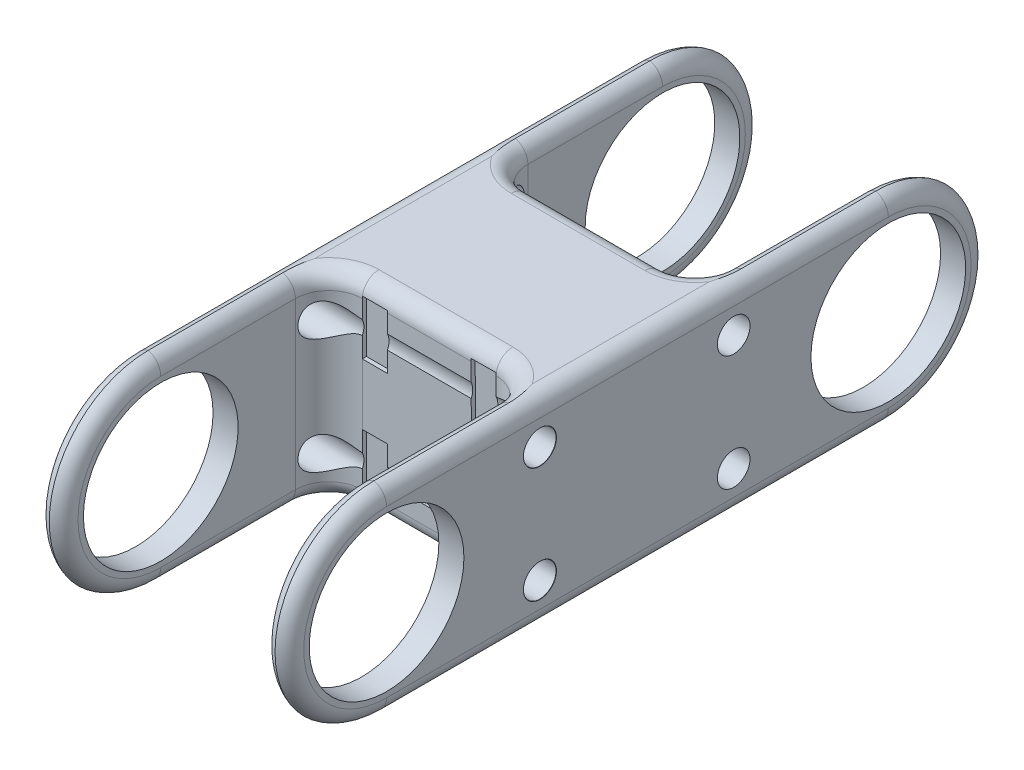
from build123d import *
from OCP.BRepAlgoAPI import BRepAlgoAPI_Cut
from OCP.TopTools import TopTools_ListOfShape

# Parameters (mm, degrees)
SKETCH1_R                        = 9.25
BOSS_EXTRUDE1_DEPTH              = 30
SKETCH2_W                        = 24
SKETCH2_H                        = 32
CUT_EXTRUDE1_DEPTH               = 82.46195431
FILLET1_R                        = 4
M3_5_CLEARANCE_HOLE1_D           = 3.9
M3_5_CLEARANCE_HOLE1_CSINK_D     = 3.95
M3_5_CLEARANCE_HOLE1_CSINK_ANGLE = 90
SKETCH5_W                        = 3
SKETCH5_H                        = 6.5
CUT_EXTRUDE2_DEPTH               = 0.5
M3_5_CLEARANCE_HOLE2_D           = 3.9
M3_5_CLEARANCE_HOLE2_CSINK_D     = 3.95
M3_5_CLEARANCE_HOLE2_CSINK_ANGLE = 90
SKETCH10_W                       = 3
SKETCH10_H                       = 6.5
CUT_EXTRUDE3_DEPTH               = 0.5
FILLET2_R                        = 2
M3_5_CLEARANCE_HOLE3_D           = 3.9
M3_5_CLEARANCE_HOLE3_CSINK_D     = 3.95
M3_5_CLEARANCE_HOLE3_CSINK_ANGLE = 90


with BuildPart() as part:
    # Sketch1 → Boss-Extrude1 (new body)
    with BuildSketch(Plane(origin=(0, 0, 0), x_dir=(0, 0, -1), z_dir=(1, 0, 0))):
        with BuildLine():
            Line((0, 11.9), (60, 11.9))
            ThreePointArc((60, 11.9), (71.9, 0), (60, -11.9))
            Line((60, -11.9), (0, -11.9))
            ThreePointArc((0, -11.9), (-11.9, 0), (0, 11.9))
        make_face()
        Circle(SKETCH1_R, mode=Mode.SUBTRACT)
        with Locations(Location((60, 0, 0), (0, 0, 180))):
            Circle(SKETCH1_R, mode=Mode.SUBTRACT)
    extrude(amount=BOSS_EXTRUDE1_DEPTH)

    # Sketch2 → Cut-Extrude1 (cut, through all)
    with BuildSketch(Plane(origin=(0, 11.9, 0), x_dir=(1, 0, 0), z_dir=(0, 1, 0))):
        with Locations((15, 4.1)):
            Rectangle(SKETCH2_W, SKETCH2_H)
        with Locations((15, 55.9)):
            Rectangle(SKETCH2_W, SKETCH2_H)
    extrude(amount=-CUT_EXTRUDE1_DEPTH, mode=Mode.SUBTRACT)

    # Fillet1
    fillet1_edges = [part.edges().sort_by_distance(p)[0] for p in [
        (27, 0, -20.1),
        (3, 0, -20.1),
        (3, 0, -39.9),
        (27, 0, -39.9),
    ]]
    fillet(fillet1_edges, radius=FILLET1_R)

    # M3.5 Clearance Hole1 (through all)
    with Locations(Plane.ZY):
        with Locations((-41.511047489, -6.9), (-41.511047489, 6.9)):
            CounterSinkHole(M3_5_CLEARANCE_HOLE1_D / 2, M3_5_CLEARANCE_HOLE1_CSINK_D / 2, counter_sink_angle=M3_5_CLEARANCE_HOLE1_CSINK_ANGLE)


with BuildPart() as cut_extrude2_tool:
    # Sketch5 → Cut-Extrude2 (new body)
    with BuildSketch(Plane(origin=(0, 0, -39.9), x_dir=(-1, 0, 0), z_dir=(0, 0, -1))):
        with Locations((-21.5, -6.9)):
            Rectangle(SKETCH5_W, SKETCH5_H)
        Polygon((-7.010026022, -10.209613265), (-10.009942628, -10.187244585), (-9.961477154, -3.687425272), (-6.961560548, -3.709793952), align=None)
        Polygon((-6.961560548, 3.709793952), (-7.010026022, 10.209613265), (-10.009942628, 10.187244585), (-9.961477154, 3.687425272), align=None)
        with Locations((-21.5, 6.9)):
            Rectangle(SKETCH5_W, SKETCH5_H)
    extrude(amount=-CUT_EXTRUDE2_DEPTH)


with BuildPart() as part_1:
    add(part.part)

    # Cut-Extrude2: cut by cut_extrude2_tool, with a tolerance
    cut_extrude2_stock = TopTools_ListOfShape()
    cut_extrude2_stock.Append(part_1.part.wrapped)
    cut_extrude2_tools = TopTools_ListOfShape()
    cut_extrude2_tools.Append(cut_extrude2_tool.part.wrapped)
    cut_extrude2_cut = BRepAlgoAPI_Cut()
    cut_extrude2_cut.SetArguments(cut_extrude2_stock)
    cut_extrude2_cut.SetTools(cut_extrude2_tools)
    cut_extrude2_cut.SetFuzzyValue(0.00001)
    cut_extrude2_cut.Build()
    add(Compound.cast(cut_extrude2_cut.Shape()).solids(), mode=Mode.REPLACE)

    # M3.5 Clearance Hole2 (through all)
    with Locations(Plane(origin=(30, 0, 0), x_dir=(0, 0, -1), z_dir=(1, 0, 0))):
        with Locations((18.34, 6.9), (18.34, -6.9)):
            CounterSinkHole(M3_5_CLEARANCE_HOLE2_D / 2, M3_5_CLEARANCE_HOLE2_CSINK_D / 2, counter_sink_angle=M3_5_CLEARANCE_HOLE2_CSINK_ANGLE)


with BuildPart() as cut_extrude3_tool:
    # Sketch10 → Cut-Extrude3 (new body)
    with BuildSketch(Plane.XY.offset(-20.1)):
        with Locations((8.5, -6.9)):
            Rectangle(SKETCH10_W, SKETCH10_H)
        Polygon((22.989973978, -10.209613265), (19.990057372, -10.187244585), (20.038522846, -3.687425272), (23.038439452, -3.709793952), align=None)
        Polygon((23.038439452, 3.709793952), (22.989973978, 10.209613265), (19.990057372, 10.187244585), (20.038522846, 3.687425272), align=None)
        with Locations((8.5, 6.9)):
            Rectangle(SKETCH10_W, SKETCH10_H)
    extrude(amount=-CUT_EXTRUDE3_DEPTH)


with BuildPart() as part_2:
    add(part_1.part)

    # Cut-Extrude3: cut by cut_extrude3_tool, with a tolerance
    cut_extrude3_stock = TopTools_ListOfShape()
    cut_extrude3_stock.Append(part_2.part.wrapped)
    cut_extrude3_tools = TopTools_ListOfShape()
    cut_extrude3_tools.Append(cut_extrude3_tool.part.wrapped)
    cut_extrude3_cut = BRepAlgoAPI_Cut()
    cut_extrude3_cut.SetArguments(cut_extrude3_stock)
    cut_extrude3_cut.SetTools(cut_extrude3_tools)
    cut_extrude3_cut.SetFuzzyValue(0.00001)
    cut_extrude3_cut.Build()
    add(Compound.cast(cut_extrude3_cut.Shape()).solids(), mode=Mode.REPLACE)

    # Fillet2
    # the kernel refuses this fillet: 2 mm, written as the material it takes off along each edge
    with BuildSketch(Plane(origin=(0, 0, -60), x_dir=(0, 1, 0), z_dir=(0, 0, 1))) as fillet2_piece_1:
        with BuildLine():
            CenterArc((11.9 - FILLET2_R, -FILLET2_R), FILLET2_R, 0, 90)
            Line((11.9, -FILLET2_R), (11.9, 0))
            Line((11.9, 0), (11.9 - FILLET2_R, 0))
        make_face()
    revolve(axis=Axis((0, 0, -60), (-1, 0, 0)), revolution_arc=180, mode=Mode.SUBTRACT)
    with BuildSketch(Plane(origin=(0, -11.9, -60), x_dir=(1, 0, 0), z_dir=(0, 0, 1)), Plane(origin=(30, 11.9, 0), x_dir=(0, -1, 0), z_dir=(0, 0, -1))) as fillet2_piece_2:
        with BuildLine():
            CenterArc((FILLET2_R, FILLET2_R), FILLET2_R, 180, 90)
            Line((0, FILLET2_R), (0, 0))
            Line((0, 0), (FILLET2_R, 0))
        make_face()
    extrude(amount=60, mode=Mode.SUBTRACT)
    with BuildSketch(Plane(origin=(0, 0, 0), x_dir=(0, -1, 0), z_dir=(0, 0, -1))) as fillet2_piece_3:
        with BuildLine():
            CenterArc((11.9 - FILLET2_R, -FILLET2_R), FILLET2_R, 0, 90)
            Line((11.9 - FILLET2_R, 0), (11.9, 0))
            Line((11.9, 0), (11.9, -FILLET2_R))
        make_face()
    revolve(axis=Axis((0, 0, 0), (-1, 0, 0)), revolution_arc=180, mode=Mode.SUBTRACT)
    with BuildSketch(Plane(origin=(3, 0, -60), x_dir=(0, -1, 0), z_dir=(0, 0, 1))) as fillet2_piece_4:
        with BuildLine():
            CenterArc((11.9 - FILLET2_R, -FILLET2_R), FILLET2_R, 0, 90)
            Line((11.9 - FILLET2_R, 0), (11.9, 0))
            Line((11.9, 0), (11.9, -FILLET2_R))
        make_face()
    revolve(axis=Axis((3, 0, -60), (1, 0, 0)), revolution_arc=180, mode=Mode.SUBTRACT)
    with BuildSketch(Plane(origin=(3, -11.9, -43.9), x_dir=(-1, 0, 0), z_dir=(0, 0, -1)), Plane(origin=(27, -11.9, -60), x_dir=(1, 0, 0), z_dir=(0, 0, 1)), Plane(origin=(27, -11.9, -16.1), x_dir=(1, 0, 0), z_dir=(0, 0, 1)), Plane(origin=(3, -11.9, 0), x_dir=(-1, 0, 0), z_dir=(0, 0, -1))) as fillet2_piece_5:
        with BuildLine():
            CenterArc((FILLET2_R, FILLET2_R), FILLET2_R, 180, 90)
            Line((0, FILLET2_R), (0, 0))
            Line((0, 0), (FILLET2_R, 0))
        make_face()
    extrude(amount=16.1, mode=Mode.SUBTRACT)
    with BuildSketch(Plane(origin=(7, -11.9, -43.9), x_dir=(-1, 0, 0), z_dir=(0, 0, -1))) as fillet2_piece_6:
        with BuildLine():
            CenterArc((4 + FILLET2_R, FILLET2_R), FILLET2_R, 180, 90)
            Line((4, FILLET2_R), (4, 0))
            Line((4, 0), (4 + FILLET2_R, 0))
        make_face()
    revolve(axis=Axis((7, -11.9, -43.9), (0, 1, 0)), revolution_arc=90, mode=Mode.SUBTRACT)
    with BuildSketch(Plane(origin=(23, -11.9, -39.9), x_dir=(0, 0, 1), z_dir=(-1, 0, 0)), Plane(origin=(7, -11.9, -20.1), x_dir=(0, 0, -1), z_dir=(1, 0, 0)), Plane(origin=(7, 11.9, -39.9), x_dir=(0, 0, 1), z_dir=(1, 0, 0)), Plane(origin=(23, 11.9, -20.1), x_dir=(0, 0, -1), z_dir=(-1, 0, 0))) as fillet2_piece_7:
        with BuildLine():
            CenterArc((FILLET2_R, FILLET2_R), FILLET2_R, 180, 90)
            Line((0, FILLET2_R), (0, 0))
            Line((0, 0), (FILLET2_R, 0))
        make_face()
    extrude(amount=16, mode=Mode.SUBTRACT)
    with BuildSketch(Plane(origin=(23, -11.9, -43.9), x_dir=(0, 0, 1), z_dir=(-1, 0, 0))) as fillet2_piece_8:
        with BuildLine():
            CenterArc((4 + FILLET2_R, FILLET2_R), FILLET2_R, 180, 90)
            Line((4, FILLET2_R), (4, 0))
            Line((4, 0), (4 + FILLET2_R, 0))
        make_face()
    revolve(axis=Axis((23, -11.9, -43.9), (0, 1, 0)), revolution_arc=90, mode=Mode.SUBTRACT)
    with BuildSketch(Plane(origin=(27, 0, -60), x_dir=(0, -1, 0), z_dir=(0, 0, 1))) as fillet2_piece_9:
        with BuildLine():
            CenterArc((11.9 - FILLET2_R, FILLET2_R), FILLET2_R, 270, 90)
            Line((11.9 - FILLET2_R, 0), (11.9, 0))
            Line((11.9, 0), (11.9, FILLET2_R))
        make_face()
    revolve(axis=Axis((27, 0, -60), (1, 0, 0)), revolution_arc=180, mode=Mode.SUBTRACT)
    with BuildSketch(Plane(origin=(30, 0, -60), x_dir=(0, 1, 0), z_dir=(0, 0, 1))) as fillet2_piece_10:
        with BuildLine():
            CenterArc((11.9 - FILLET2_R, FILLET2_R), FILLET2_R, 270, 90)
            Line((11.9, FILLET2_R), (11.9, 0))
            Line((11.9, 0), (11.9 - FILLET2_R, 0))
        make_face()
    revolve(axis=Axis((30, 0, -60), (-1, 0, 0)), revolution_arc=180, mode=Mode.SUBTRACT)
    with BuildSketch(Plane(origin=(30, -11.9, -60), x_dir=(-1, 0, 0), z_dir=(0, 0, 1)), Plane(origin=(0, 11.9, 0), x_dir=(0, -1, 0), z_dir=(0, 0, -1))) as fillet2_piece_11:
        with BuildLine():
            CenterArc((FILLET2_R, -FILLET2_R), FILLET2_R, 90, 90)
            Line((0, -FILLET2_R), (0, 0))
            Line((0, 0), (FILLET2_R, 0))
        make_face()
    extrude(amount=60, mode=Mode.SUBTRACT)
    with BuildSketch(Plane(origin=(30, 0, 0), x_dir=(0, -1, 0), z_dir=(0, 0, -1))) as fillet2_piece_12:
        with BuildLine():
            CenterArc((11.9 - FILLET2_R, FILLET2_R), FILLET2_R, 270, 90)
            Line((11.9 - FILLET2_R, 0), (11.9, 0))
            Line((11.9, 0), (11.9, FILLET2_R))
        make_face()
    revolve(axis=Axis((30, 0, 0), (-1, 0, 0)), revolution_arc=180, mode=Mode.SUBTRACT)
    with BuildSketch(Plane(origin=(27, 0, 0), x_dir=(0, -1, 0), z_dir=(0, 0, -1))) as fillet2_piece_13:
        with BuildLine():
            CenterArc((11.9 - FILLET2_R, -FILLET2_R), FILLET2_R, 0, 90)
            Line((11.9, -FILLET2_R), (11.9, 0))
            Line((11.9, 0), (11.9 - FILLET2_R, 0))
        make_face()
    revolve(axis=Axis((27, 0, 0), (-1, 0, 0)), revolution_arc=180, mode=Mode.SUBTRACT)
    with BuildSketch(Plane(origin=(23, -11.9, -16.1), x_dir=(1, 0, 0), z_dir=(0, 0, 1))) as fillet2_piece_14:
        with BuildLine():
            CenterArc((4 + FILLET2_R, FILLET2_R), FILLET2_R, 180, 90)
            Line((4, FILLET2_R), (4, 0))
            Line((4, 0), (4 + FILLET2_R, 0))
        make_face()
    revolve(axis=Axis((23, -11.9, -16.1), (0, 1, 0)), revolution_arc=90, mode=Mode.SUBTRACT)
    with BuildSketch(Plane(origin=(7, -11.9, -16.1), x_dir=(0, 0, -1), z_dir=(1, 0, 0))) as fillet2_piece_15:
        with BuildLine():
            CenterArc((4 + FILLET2_R, FILLET2_R), FILLET2_R, 180, 90)
            Line((4, FILLET2_R), (4, 0))
            Line((4, 0), (4 + FILLET2_R, 0))
        make_face()
    revolve(axis=Axis((7, -11.9, -16.1), (0, 1, 0)), revolution_arc=90, mode=Mode.SUBTRACT)
    with BuildSketch(Plane(origin=(3, 0, 0), x_dir=(0, -1, 0), z_dir=(0, 0, -1))) as fillet2_piece_16:
        with BuildLine():
            CenterArc((11.9 - FILLET2_R, FILLET2_R), FILLET2_R, 270, 90)
            Line((11.9, FILLET2_R), (11.9, 0))
            Line((11.9, 0), (11.9 - FILLET2_R, 0))
        make_face()
    revolve(axis=Axis((3, 0, 0), (-1, 0, 0)), revolution_arc=180, mode=Mode.SUBTRACT)
    with BuildSketch(Plane(origin=(3, 11.9, -60), x_dir=(0, -1, 0), z_dir=(0, 0, 1)), Plane(origin=(27, 11.9, -43.9), x_dir=(0, -1, 0), z_dir=(0, 0, -1)), Plane(origin=(27, 11.9, 0), x_dir=(0, -1, 0), z_dir=(0, 0, -1)), Plane(origin=(3, 11.9, -16.1), x_dir=(0, -1, 0), z_dir=(0, 0, 1))) as fillet2_piece_17:
        with BuildLine():
            CenterArc((FILLET2_R, -FILLET2_R), FILLET2_R, 90, 90)
            Line((0, -FILLET2_R), (0, 0))
            Line((0, 0), (FILLET2_R, 0))
        make_face()
    extrude(amount=16.1, mode=Mode.SUBTRACT)
    with BuildSketch(Plane(origin=(7, 11.9, -43.9), x_dir=(-1, 0, 0), z_dir=(0, 0, -1))) as fillet2_piece_18:
        with BuildLine():
            CenterArc((4 + FILLET2_R, -FILLET2_R), FILLET2_R, 90, 90)
            Line((4 + FILLET2_R, 0), (4, 0))
            Line((4, 0), (4, -FILLET2_R))
        make_face()
    revolve(axis=Axis((7, 11.9, -43.9), (0, 1, 0)), revolution_arc=90, mode=Mode.SUBTRACT)
    with BuildSketch(Plane(origin=(23, 11.9, -43.9), x_dir=(0, 0, 1), z_dir=(-1, 0, 0))) as fillet2_piece_19:
        with BuildLine():
            CenterArc((4 + FILLET2_R, -FILLET2_R), FILLET2_R, 90, 90)
            Line((4 + FILLET2_R, 0), (4, 0))
            Line((4, 0), (4, -FILLET2_R))
        make_face()
    revolve(axis=Axis((23, 11.9, -43.9), (0, 1, 0)), revolution_arc=90, mode=Mode.SUBTRACT)
    with BuildSketch(Plane(origin=(23, 11.9, -16.1), x_dir=(1, 0, 0), z_dir=(0, 0, 1))) as fillet2_piece_20:
        with BuildLine():
            CenterArc((4 + FILLET2_R, -FILLET2_R), FILLET2_R, 90, 90)
            Line((4 + FILLET2_R, 0), (4, 0))
            Line((4, 0), (4, -FILLET2_R))
        make_face()
    revolve(axis=Axis((23, 11.9, -16.1), (0, 1, 0)), revolution_arc=90, mode=Mode.SUBTRACT)
    with BuildSketch(Plane(origin=(7, 11.9, -16.1), x_dir=(0, 0, -1), z_dir=(1, 0, 0))) as fillet2_piece_21:
        with BuildLine():
            CenterArc((4 + FILLET2_R, -FILLET2_R), FILLET2_R, 90, 90)
            Line((4 + FILLET2_R, 0), (4, 0))
            Line((4, 0), (4, -FILLET2_R))
        make_face()
    revolve(axis=Axis((7, 11.9, -16.1), (0, 1, 0)), revolution_arc=90, mode=Mode.SUBTRACT)

    # M3.5 Clearance Hole3 (through all)
    with Locations(Plane(origin=(30, 0, 0), x_dir=(0, 0, -1), z_dir=(1, 0, 0))):
        with Locations((18.34, 6.9), (18.34, -6.9)):
            CounterSinkHole(M3_5_CLEARANCE_HOLE3_D / 2, M3_5_CLEARANCE_HOLE3_CSINK_D / 2, counter_sink_angle=M3_5_CLEARANCE_HOLE3_CSINK_ANGLE)


solid = part_2.part
